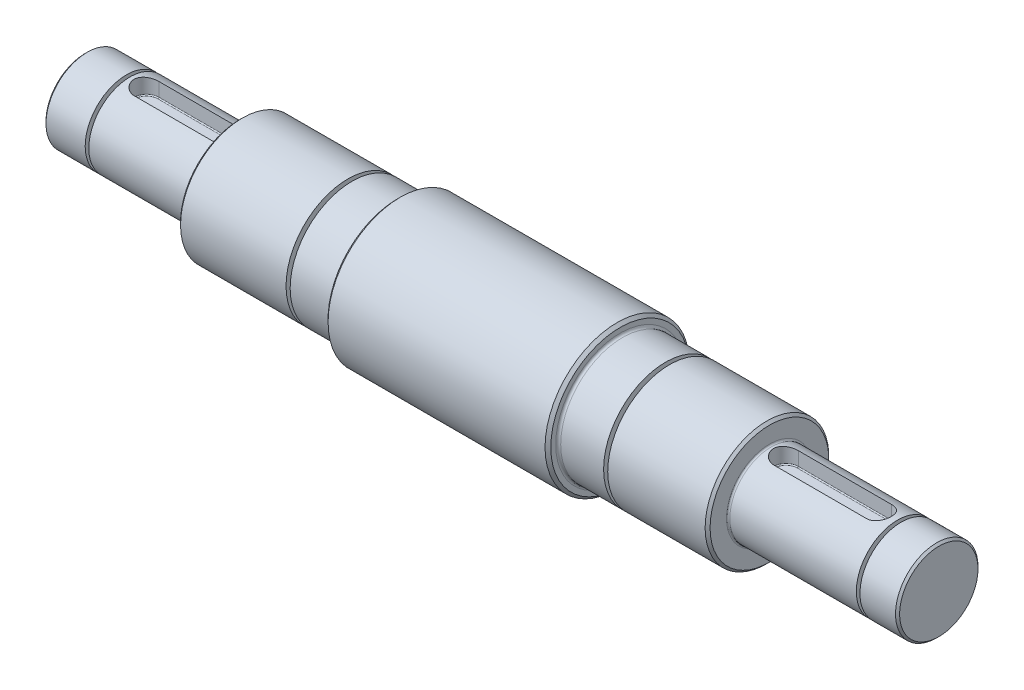
from build123d import *

# Parameters (mm, degrees)
MIRROR1_START       = 69.0425
MIRROR1_OUTLINE_R   = 30
MIRROR1_OUTLINE_R_2 = 24.2
MIRROR1_DEPTH       = 2
SKETCH4_R           = 20
BOSS_EXTRUDE1_DEPTH = 20
SKETCH5_W           = 1.75
SKETCH5_H           = 4.4
CUT_EXTRUDE1_DEPTH  = 37.3
FILLET1_R           = 0.8
CHAMFER1_SIZE       = 1.2
FILLET2_R           = 1.2
CHAMFER2_SIZE       = 1.4
CHAMFER3_SIZE       = 1.4
FILLET3_R           = 1.2
CHAMFER4_SIZE       = 1.2
FILLET4_R           = 0.8
CUT_EXTRUDE2_START  = 45.13
CUT_EXTRUDE2_DEPTH  = 45.13
CUT_EXTRUDE3_DEPTH  = 8
FILLET5_R           = 0.5
CUT_EXTRUDE4_DEPTH  = 8
FILLET6_R           = 0.4
FILLET10_R          = 0.4
FILLET12_R          = 0.4
FILLET13_R          = 0.4
FILLET14_R          = 0.5
CHAMFER5_SIZE       = 1
CHAMFER6_SIZE       = 1


# Read off the part's stored shape, not the designer's step: Mirror1
with BuildPart() as part:
    # Sketch2 → Revolve1 (revolve)
    with BuildSketch(Plane.XY, mode=Mode.PRIVATE) as revolve1_sk:
        Polygon((-137.307500742, 20), (-137.307500742, 30), (-84.9575, 30), (-84.9575, 24.2), (-82.9575, 24.2), (-82.9575, 30), (-60.9575, 30), (-60.9575, 35), (47.0425, 35), (47.0425, 30), (119.4775, 30), (119.4775, 20), (181.6075, 20), (181.6075, 0), (-181.6075, 0), (-212.357500742, 0), (-212.357500742, 20), (-192.357500742, 20), (-192.357500742, 15.6), (-190.607500742, 15.6), (-190.607500742, 20), align=None)
    revolve(revolve1_sk.sketch.rotate(Axis((-181.6075, 0, 0), (1, 0, 0)), 90), axis=Axis((-181.6075, 0, 0), (1, 0, 0)))

    # Mirror1 outline → Mirror1 (cut)
    with BuildSketch(Plane.YZ.offset(MIRROR1_START)):
        Circle(MIRROR1_OUTLINE_R)
        Circle(MIRROR1_OUTLINE_R_2, mode=Mode.SUBTRACT)
    extrude(amount=MIRROR1_DEPTH, mode=Mode.SUBTRACT)

    # Sketch6 → Cut-Extrude1 (cut)
    with BuildSketch(Plane.ZY.offset(145.307500742)):
        with BuildLine():
            Line((-6, 12), (6, 12))
            Line((6, 12), (6, 19.078784028))
            ThreePointArc((6, 19.078784028), (0, 20), (-6, 19.078784028))
            Line((-6, 19.078784028), (-6, 12))
        make_face()
    extrude(amount=CUT_EXTRUDE1_DEPTH, mode=Mode.SUBTRACT)

    # Fillet1
    fillet1_edges = [part.edges().sort_by_distance(p)[0] for p in [
        (-137.307500742, 0, -20),
    ]]
    fillet(fillet1_edges, radius=FILLET1_R)

    # Chamfer1
    chamfer1_edges = [part.edges().sort_by_distance(p)[0] for p in [
        (-137.307500742, 0, -30),
    ]]
    chamfer(chamfer1_edges, length=CHAMFER1_SIZE)

    # Fillet2
    fillet2_edges = [part.edges().sort_by_distance(p)[0] for p in [
        (-60.9575, 0, -30),
    ]]
    fillet(fillet2_edges, radius=FILLET2_R)

    # Chamfer2
    chamfer2_edges = [part.edges().sort_by_distance(p)[0] for p in [
        (-60.9575, 0, -35),
    ]]
    chamfer(chamfer2_edges, length=CHAMFER2_SIZE)

    # Chamfer3
    chamfer3_edges = [part.edges().sort_by_distance(p)[0] for p in [
        (47.0425, 0, -35),
    ]]
    chamfer(chamfer3_edges, length=CHAMFER3_SIZE)

    # Fillet3
    fillet3_edges = [part.edges().sort_by_distance(p)[0] for p in [
        (47.0425, 0, -30),
    ]]
    fillet(fillet3_edges, radius=FILLET3_R)

    # Chamfer4
    chamfer4_edges = [part.edges().sort_by_distance(p)[0] for p in [
        (119.4775, 0, -30),
    ]]
    chamfer(chamfer4_edges, length=CHAMFER4_SIZE)

    # Fillet4
    fillet4_edges = [part.edges().sort_by_distance(p)[0] for p in [
        (119.4775, 0, -20),
    ]]
    fillet(fillet4_edges, radius=FILLET4_R)

    # Sketch7 → Cut-Extrude2 (cut)
    with BuildSketch(Plane(origin=(127.4775, 0, 0), x_dir=(0, 0, -1), z_dir=(1, 0, 0)).offset(CUT_EXTRUDE2_START)):
        with BuildLine():
            Line((-6, 12), (6, 12))
            Line((6, 12), (6, 19.078784028))
            ThreePointArc((6, 19.078784028), (0, 20), (-6, 19.078784028))
            Line((-6, 19.078784028), (-6, 12))
        make_face()
    extrude(amount=-CUT_EXTRUDE2_DEPTH, mode=Mode.SUBTRACT)

    # Sketch8 → Cut-Extrude3 (cut)
    with BuildSketch(Plane(origin=(0, 20, 0), x_dir=(1, 0, 0), z_dir=(0, 1, 0))):
        with BuildLine():
            Line((-145.307500742, 6), (-145.307500742, -6))
            ThreePointArc((-145.307500742, -6), (-139.307500742, 0), (-145.307500742, 6))
        make_face()
        with BuildLine():
            Line((-182.607500742, -6), (-182.607500742, 6))
            ThreePointArc((-182.607500742, 6), (-188.607500742, 0), (-182.607500742, -6))
        make_face()
    extrude(amount=-CUT_EXTRUDE3_DEPTH, mode=Mode.SUBTRACT)

    # Fillet5
    fillet5_edges = [part.edges().sort_by_distance(p)[0] for p in [
        (-139.307500742, 12, 0),
        (-188.607500742, 12, 0),
        (-163.957500742, 12, 6),
        (-163.957500742, 12, -6),
    ]]
    fillet(fillet5_edges, radius=FILLET5_R)

    # Sketch9 → Cut-Extrude4 (cut)
    with BuildSketch(Plane(origin=(0, 20, 0), x_dir=(1, 0, 0), z_dir=(0, 1, 0))):
        with BuildLine():
            Line((127.4775, 6), (127.4775, -6))
            ThreePointArc((127.4775, -6), (121.4775, 0), (127.4775, 6))
        make_face()
        with BuildLine():
            Line((172.6075, 6), (172.6075, -6))
            ThreePointArc((172.6075, -6), (178.6075, 0), (172.6075, 6))
        make_face()
    extrude(amount=-CUT_EXTRUDE4_DEPTH, mode=Mode.SUBTRACT)

    # Fillet6
    fillet6_edges = [part.edges().sort_by_distance(p)[0] for p in [
        (69.0425, -24.2, 0),
        (71.0425, -24.2, 0),
    ]]
    fillet(fillet6_edges, radius=FILLET6_R)

    # Fillet12
    fillet12_edges = [part.edges().sort_by_distance(p)[0] for p in [
        (-84.9575, 0, -24.2),
        (-82.9575, 0, -24.2),
    ]]
    fillet(fillet12_edges, radius=FILLET12_R)

    # Fillet13
    fillet13_edges = [part.edges().sort_by_distance(p)[0] for p in [
        (-192.357500742, 0, -15.6),
        (-190.607500742, 0, -15.6),
    ]]
    fillet(fillet13_edges, radius=FILLET13_R)



with BuildPart() as body_2:
    # Sketch4 → Boss-Extrude1 (new body)
    with BuildSketch(Plane(origin=(181.6075, 0, 0), x_dir=(0, 0, -1), z_dir=(1, 0, 0))):
        Circle(SKETCH4_R)
    extrude(amount=BOSS_EXTRUDE1_DEPTH)

    # Sketch5 → Cut-Revolve1 (revolve, cut)
    with BuildSketch(Plane.XY, mode=Mode.PRIVATE) as cut_revolve1_sk:
        with Locations((182.4825, 17.8)):
            Rectangle(SKETCH5_W, SKETCH5_H)
    revolve(cut_revolve1_sk.sketch.rotate(Axis((201.6075, 0, 0), (-1, 0, 0)), 90), axis=Axis((201.6075, 0, 0), (-1, 0, 0)), mode=Mode.SUBTRACT)

    # Fillet10
    fillet10_edges = [body_2.edges().sort_by_distance(p)[0] for p in [
        (183.3575, 0, 15.6),
    ]]
    fillet(fillet10_edges, radius=FILLET10_R)


with BuildPart() as part_1:
    add(part.part)

    add(body_2.part)  # Revolve3 merges body 2
    # Sketch11 → Revolve3 (revolve)
    with BuildSketch(Plane.XY, mode=Mode.PRIVATE) as revolve3_sk:
        with BuildLine():
            Line((181.6075, 16), (181.6075, 15.6))
            Line((181.6075, 15.6), (182.0075, 15.6))
            ThreePointArc((182.0075, 15.6), (181.724657288, 15.717157288), (181.6075, 16))
        make_face()
    revolve(revolve3_sk.sketch.rotate(Axis((201.6075, 0, 0), (-1, 0, 0)), 90), axis=Axis((201.6075, 0, 0), (-1, 0, 0)))

    # Fillet14
    fillet14_edges = [part_1.edges().sort_by_distance(p)[0] for p in [
        (150.0425, 12, 6),
        (150.0425, 12, -6),
        (121.4775, 12, 0),
        (178.6075, 12, 0),
    ]]
    fillet(fillet14_edges, radius=FILLET14_R)

    # Chamfer5
    chamfer5_edges = [part_1.edges().sort_by_distance(p)[0] for p in [
        (201.6075, 0, 20),
    ]]
    chamfer(chamfer5_edges, length=CHAMFER5_SIZE)

    # Chamfer6
    chamfer6_edges = [part_1.edges().sort_by_distance(p)[0] for p in [
        (-212.357500742, 0, -20),
    ]]
    chamfer(chamfer6_edges, length=CHAMFER6_SIZE)


solid = part_1.part
